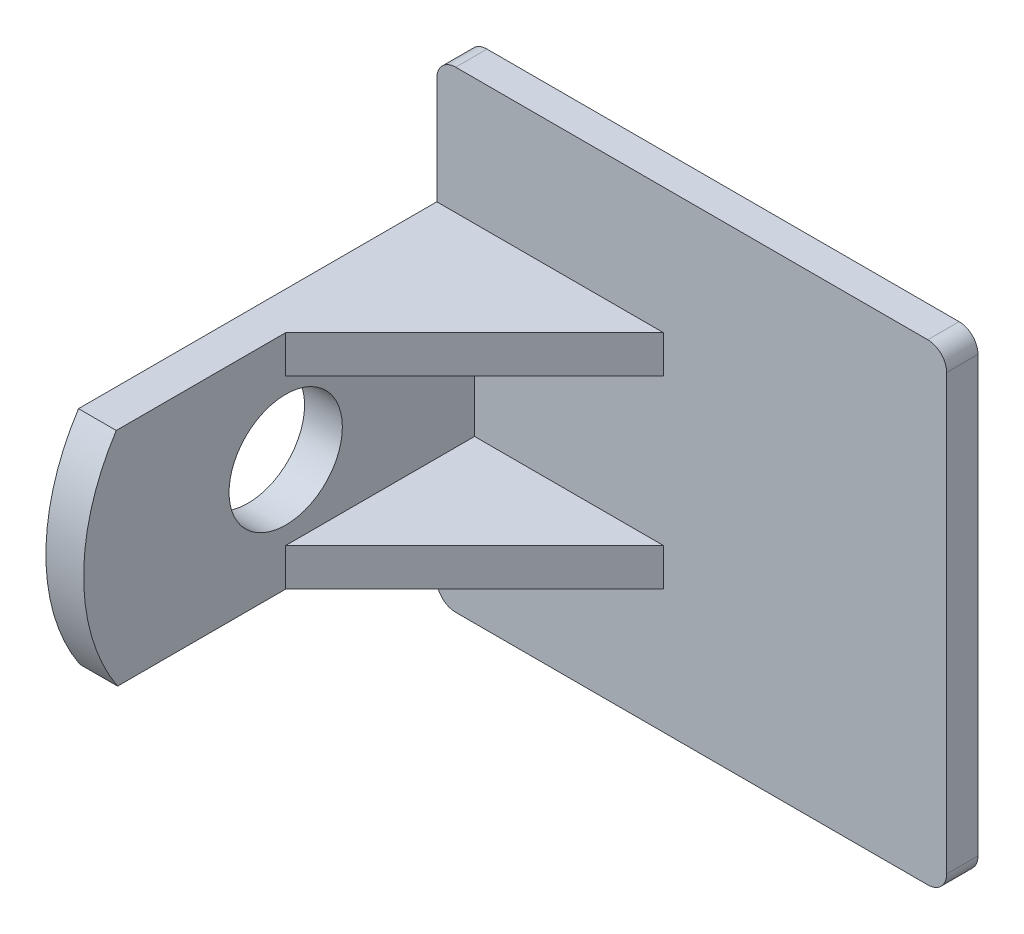
from build123d import *

# Parameters (mm, degrees)
SKETCH_1_R      = 3
EXTRUDE_1_DEPTH = 2
SKETCH_2_W      = 1.658688852
SKETCH_2_H      = 25
EXTRUDE_2_DEPTH = 25
EXTRUDE_3_DEPTH = 2
EXTRUDE_4_DEPTH = 2
SKETCH_5_W      = 1.658688852
SKETCH_5_H      = 25
EXTRUDE_5_DEPTH = 2
FILLET_1_R      = 1


with BuildPart() as part:
    # 草图1 → 凸台-拉伸1 (new body)
    with BuildSketch(Plane(origin=(0, 0, 0), x_dir=(0, 0, -1), z_dir=(1, 0, 0))):
        with BuildLine():
            Line((11.658688852, -5.93481554), (11.658688852, 5.826739946))
            Line((11.658688852, 5.826739946), (-8.341311148, 5.826739946))
            Line((-8.341311148, 5.826739946), (-8.972547589, 5.826739946))
            ThreePointArc((-8.972547589, 5.826739946), (-10.698286038, -0.064687535), (-8.90143096, -5.93481554))
            Line((-8.90143096, -5.93481554), (0, -5.93481554))
            Line((0, -5.93481554), (11.658688852, -5.93481554))
        make_face()
        Circle(SKETCH_1_R, mode=Mode.SUBTRACT)
    extrude(amount=EXTRUDE_1_DEPTH)

    # 草图2 → 凸台-拉伸2 (add)
    with BuildSketch(Plane(origin=(2, 0, 0), x_dir=(0, 0, -1), z_dir=(1, 0, 0))):
        with Locations((10.829344426, 0)):
            Rectangle(SKETCH_2_W, SKETCH_2_H)
    extrude(amount=EXTRUDE_2_DEPTH)

    # 草图3 → 凸台-拉伸3 (add)
    with BuildSketch(Plane(origin=(0, 5.826739946, 0), x_dir=(1, 0, 0), z_dir=(0, 1, 0))):
        Polygon((2, 0), (12, 10), (2, 10), align=None)
    extrude(amount=-EXTRUDE_3_DEPTH)

    # 草图4 → 凸台-拉伸4 (add)
    with BuildSketch(Plane(origin=(0, -5.93481554, -5.93481554), x_dir=(1, 0, 0), z_dir=(0, 1, 0))):
        Polygon((2, -5.93481554), (12, 4.06518446), (2, 4.06518446), align=None)
    extrude(amount=EXTRUDE_4_DEPTH)

    # 草图5 → 凸台-拉伸5 (add)
    with BuildSketch(Plane.ZY.offset(-2)):
        with Locations((-10.829344426, 0)):
            Rectangle(SKETCH_5_W, SKETCH_5_H)
    extrude(amount=EXTRUDE_5_DEPTH)

    # 圆角1
    fillet_1_edges = [part.edges().sort_by_distance(p)[0] for p in [
        (0, 12.5, -10.829344426),
        (27, 12.5, -10.829344426),
        (27, -12.5, -10.829344426),
        (0, -12.5, -10.829344426),
    ]]
    fillet(fillet_1_edges, radius=FILLET_1_R)


solid = part.part
